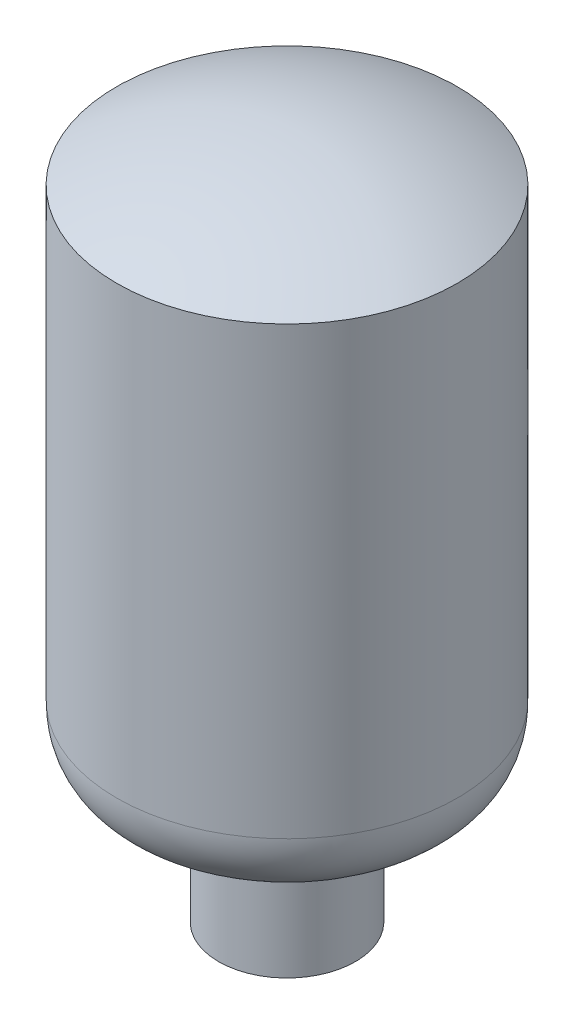
from build123d import *

# Parameters (mm, degrees)
SKETCH1_R           = 21.5
BOSS_EXTRUDE1_DEPTH = 28
SHELL2_T            = -1.5


with BuildPart() as part:
    # Sketch1 → Boss-Extrude1 (new body)
    with BuildSketch(Plane(origin=(0, 0, 0), x_dir=(1, 0, 0), z_dir=(0, 1, 0))):
        Circle(SKETCH1_R)
    extrude(amount=BOSS_EXTRUDE1_DEPTH)

    # Sketch2 → Revolve1 (revolve)
    with BuildSketch(Plane.XY):
        with BuildLine():
            Line((0, 28), (21.5, 28))
            Line((21.5, 28), (26.791502622, 34))
            add(Edge.make_bspline(
                [(26.791502622, 34), (31.5, 35.243470115), (31.5, 38.5)],
                knots=[0, 0, 0, 1, 1, 1], degree=2))
            add(Edge.make_bspline(
                [(31.5, 38.5), (41.870892626, 38.488096287), (53.5, 45.205749348), (53.5, 60.5)],
                knots=[0, 0, 0, 0, 1, 1, 1, 1], degree=3))
            Line((53.5, 60.5), (53.5, 200.5))
            Line((53.5, 200.5), (0, 200.5))
            Line((0, 200.5), (0, 28))
        make_face()
    revolve(axis=Axis((0, 200.5, 0), (0, -1, 0)))

    # Sketch3 → Revolve2 (revolve)
    with BuildSketch(Plane.XY):
        with BuildLine():
            Line((0, 200.5), (53.5, 200.5))
            add(Edge.make_bspline(
                [(53.5, 200.5), (27.650723318, 214.5), (0, 214.5)],
                knots=[0, 0, 0, 1, 1, 1], degree=2))
            Line((0, 214.5), (0, 200.5))
        make_face()
    revolve(axis=Axis((0, 214.5, 0), (0, -1, 0)))

    # Shell2
    shell2_openings = [part.faces().sort_by_distance(p)[0] for p in [
        (0, 0, 0),
    ]]
    offset(amount=SHELL2_T, openings=shell2_openings, kind=Kind.INTERSECTION)


solid = part.part
